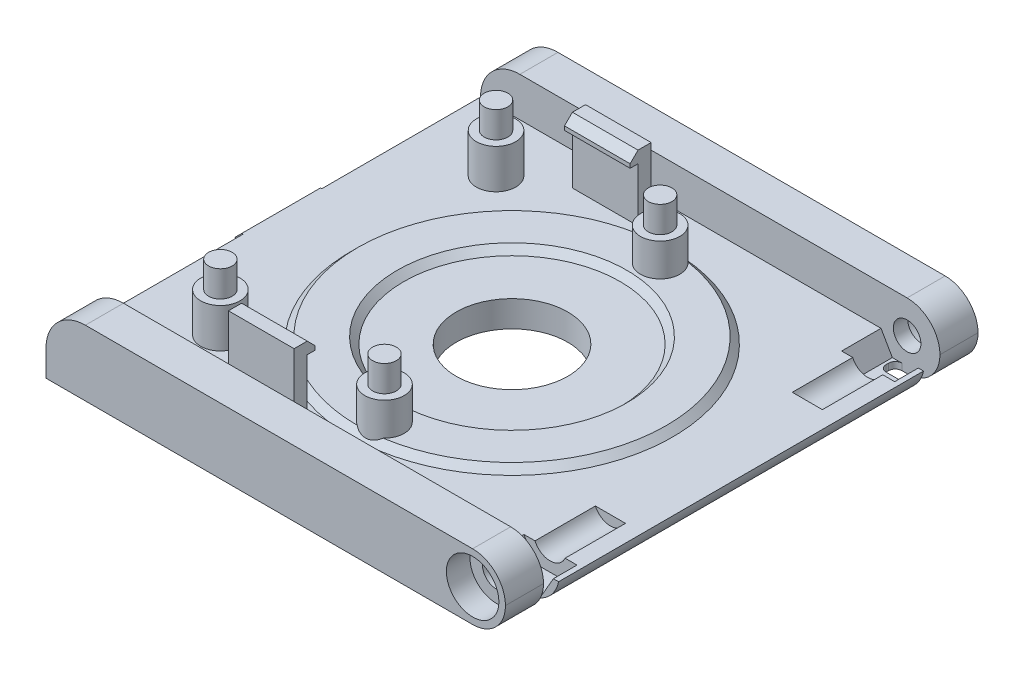
from build123d import *

# Parameters (mm, degrees)
EXTRUDE_2_DEPTH      = 7
EXTRUDE_4_DEPTH      = 1
SKETCH_7_W           = 0.8
SKETCH_7_H           = 10
EXTRUDE_8_DEPTH      = 2.8
SKETCH_8_R           = 0.7
EXTRUDE_9_DEPTH      = 10
FILLET_3_R           = 0.5
SKETCH_13_W          = 0.8
SKETCH_13_H          = 2
CUT_EXTRUDE_2_DEPTH  = 1
CUT_EXTRUDE_START    = -5
CUT_EXTRUDE_3_DEPTH  = 5
SKETCH_19_R          = 4.25
CUT_EXTRUDE_4_DEPTH  = 3
SKETCH_21_R          = 1.5
EXTRUDE_11_DEPTH     = 3
SKETCH_22_R          = 0.9
EXTRUDE_12_DEPTH     = 2
SKETCH_28_W          = 5
SKETCH_28_H          = 1
EXTRUDE_16_DEPTH     = 5
FILLET_4_R           = 1
SKETCH_29_W          = 5
SKETCH_29_H          = 0.9
EXTRUDE_17_DEPTH     = 0.6
SKETCH_30_W          = 5
SKETCH_30_H          = 0.9
EXTRUDE_18_DEPTH     = 0.6
CHAMFER_5_SIZE       = 0.6
CUT_EXTRUDE_5_DEPTH  = 0.5
SKETCH_34_W          = 0.8
SKETCH_34_H          = 12
CUT_EXTRUDE_6_DEPTH  = 1
SKETCH_35_W          = 0.8
SKETCH_35_H          = 10
EXTRUDE_19_DEPTH     = 2.8
SKETCH_36_R          = 0.7
EXTRUDE_20_DEPTH     = 10
FILLET_5_R           = 0.5
FILLET_6_R           = 1
SKETCH_37_R          = 11.75
SKETCH_37_R_2        = 9.25
CUT_EXTRUDE_7_DEPTH  = 1.5
CHAMFER_6_SIZE       = 1.2
CHAMFER_7_SIZE       = 0.5
SKETCH_38_R          = 12.25
SKETCH_38_R_2        = 8.25
EXTRUDE_21_DEPTH     = 0.5
CHAMFER_8_SIZE       = 0.5
SKETCH_39_W          = 27.918227535
SKETCH_39_H          = 36
SKETCH_39_W_2        = 30.545728302
CUT_EXTRUDE_8_DEPTH  = 10
SKETCH_40_W          = 35
SKETCH_40_H          = 3
CUT_EXTRUDE_9_DEPTH  = 2.9
SKETCH_41_W          = 35
SKETCH_41_H          = 3
CUT_EXTRUDE_10_DEPTH = 2.9
FILLET_9_R           = 2.5
CUT_EXTRUDE_12_REACH = 40.823
SKETCH_44_R          = 1.05
FILLET_10_R          = 3
CUT_EXTRUDE_14_REACH = 40.823
SKETCH_47_R          = 1.05
SKETCH_50_R          = 2
CUT_EXTRUDE_17_DEPTH = 1.8
CUT_EXTRUDE_START_2  = -1.8
SKETCH_51_R          = 2
CUT_EXTRUDE_18_DEPTH = 1.8
CUT_EXTRUDE_21_DEPTH = 3
CUT_EXTRUDE_22_DEPTH = 3
CUT_EXTRUDE_23_REACH = 38.299
SKETCH_57_R          = 1.25
SKETCH_58_W          = 3.4
SKETCH_58_H          = 1.2
CUT_EXTRUDE_24_DEPTH = 10
SKETCH_59_W          = 2.291287848
SKETCH_59_H          = 15
EXTRUDE_22_DEPTH     = 1.5
FILLET_11_R          = 0.5
SKETCH_62_W          = 6
SKETCH_62_H          = 1
EXTRUDE_25_DEPTH     = 0.6
CHAMFER_10_SIZE      = 0.5


# Some blends are built 0.0001 mm under size
with BuildPart() as part:
    # case 2 → 凸台-拉伸2 (new body)
    with BuildSketch(Plane(origin=(0, 0, 0), x_dir=(1, 0, 0), z_dir=(0, 1, 0))):
        with BuildLine():
            Line((-34.042196447, 18), (30.957803553, 18))
            ThreePointArc((30.957803553, 18), (34.493337459, 16.535533906), (35.957803553, 13))
            Line((35.957803553, 13), (35.957803553, -13))
            ThreePointArc((35.957803553, -13), (34.493337459, -16.535533906), (30.957803553, -18))
            Line((30.957803553, -18), (-34.042196447, -18))
            ThreePointArc((-34.042196447, -18), (-37.577730353, -16.535533906), (-39.042196447, -13))
            Line((-39.042196447, -13), (-39.042196447, 13))
            ThreePointArc((-39.042196447, 13), (-37.577730353, 16.535533906), (-34.042196447, 18))
        make_face()
    extrude(amount=EXTRUDE_2_DEPTH)

    # 草图3 → 凸台-拉伸4 (add)
    with BuildSketch(Plane(origin=(0, 7, 0), x_dir=(1, 0, 0), z_dir=(0, 1, 0))):
        with BuildLine():
            Line((-36.942196447, 13), (-36.942196447, -13))
            ThreePointArc((-36.942196447, -13), (-35.997398295, -14.955201848), (-34.042196447, -15.9))
            Line((-34.042196447, -15.9), (30.957803553, -15.9))
            ThreePointArc((30.957803553, -15.9), (32.913005401, -14.955201848), (33.857803553, -13))
            Line((33.857803553, -13), (33.857803553, 13))
            ThreePointArc((33.857803553, 13), (32.913005401, 14.955201848), (30.957803553, 15.9))
            Line((30.957803553, 15.9), (-34.042196447, 15.9))
            ThreePointArc((-34.042196447, 15.9), (-35.997398295, 14.955201848), (-36.942196447, 13))
        make_face()
        with BuildLine():
            Line((-34.042196447, -15.1), (30.957803553, -15.1))
            ThreePointArc((30.957803553, -15.1), (32.371630665, -14.413827112), (33.057803553, -13))
            Line((33.057803553, -13), (33.057803553, 13))
            ThreePointArc((33.057803553, 13), (32.371630665, 14.413827112), (30.957803553, 15.1))
            Line((30.957803553, 15.1), (-34.042196447, 15.1))
            ThreePointArc((-34.042196447, 15.1), (-35.456023559, 14.413827112), (-36.142196447, 13))
            Line((-36.142196447, 13), (-36.142196447, -13))
            ThreePointArc((-36.142196447, -13), (-35.456023559, -14.413827112), (-34.042196447, -15.1))
        make_face(mode=Mode.SUBTRACT)
    extrude(amount=EXTRUDE_4_DEPTH)

    # 草图7 → 凸台-拉伸8 (add)
    with BuildSketch(Plane(origin=(0, 7, 0), x_dir=(1, 0, 0), z_dir=(0, 1, 0))):
        with Locations((-36.542196447, 0)):
            Rectangle(SKETCH_7_W, SKETCH_7_H)
    extrude(amount=EXTRUDE_8_DEPTH)

    # 草图8 → 凸台-拉伸9 (add)
    with BuildSketch(Plane.XY.offset(5)):
        with Locations((-36.692196447, 8.6)):
            Circle(SKETCH_8_R)
    extrude(amount=-EXTRUDE_9_DEPTH)

    # 圆角3
    fillet_3_edges = [part.edges().sort_by_distance(p)[0] for p in [
        (-36.942196447, 9.8, 0),
    ]]
    fillet(fillet_3_edges, radius=FILLET_3_R)

    # 草图13 → 切除-拉伸2 (cut)
    with BuildSketch(Plane(origin=(0, 8, 0), x_dir=(1, 0, 0), z_dir=(0, 1, 0))):
        with Locations((-36.542196447, -6)):
            Rectangle(SKETCH_13_W, SKETCH_13_H)
        with Locations((-36.542196447, 6)):
            Rectangle(SKETCH_13_W, SKETCH_13_H)
    extrude(amount=-CUT_EXTRUDE_2_DEPTH, mode=Mode.SUBTRACT)

    # 草图15 → 切除-拉伸3 (cut)
    with BuildSketch(Plane(origin=(0, 7, 0), x_dir=(1, 0, 0), z_dir=(0, 1, 0)).offset(CUT_EXTRUDE_START)):
        with BuildLine():
            Line((-34.042196447, -15.1), (30.957803553, -15.1))
            ThreePointArc((30.957803553, -15.1), (32.371630665, -14.413827112), (33.057803553, -13))
            Line((33.057803553, -13), (33.057803553, 13))
            ThreePointArc((33.057803553, 13), (32.371630665, 14.413827112), (30.957803553, 15.1))
            Line((30.957803553, 15.1), (-34.042196447, 15.1))
            ThreePointArc((-34.042196447, 15.1), (-35.456023559, 14.413827112), (-36.142196447, 13))
            Line((-36.142196447, 13), (-36.142196447, -13))
            ThreePointArc((-36.142196447, -13), (-35.456023559, -14.413827112), (-34.042196447, -15.1))
        make_face()
    extrude(amount=CUT_EXTRUDE_3_DEPTH, mode=Mode.SUBTRACT)

    # 草图19 → 切除-拉伸4 (cut)
    with BuildSketch(Plane(origin=(0, 2, 0), x_dir=(1, 0, 0), z_dir=(0, 1, 0))):
        with Locations(Location((-1.542196447, 0, 0), (0, 0, 270))):
            Circle(SKETCH_19_R)
    extrude(amount=-CUT_EXTRUDE_4_DEPTH, mode=Mode.SUBTRACT)

    # 草图21 → 凸台-拉伸11 (add)
    with BuildSketch(Plane(origin=(0, 2, 0), x_dir=(1, 0, 0), z_dir=(0, 1, 0))):
        with Locations(Location((-13.257466081, 10.5, 0), (0, 0, 270))):
            Circle(SKETCH_21_R)
        with Locations(Location((-0.757466081, 10.5, 0), (0, 0, 270))):
            Circle(SKETCH_21_R)
        with Locations(Location((-13.257466081, -10.5, 0), (0, 0, 270))):
            Circle(SKETCH_21_R)
        with Locations(Location((-0.757466081, -10.5, 0), (0, 0, 270))):
            Circle(SKETCH_21_R)
    extrude(amount=EXTRUDE_11_DEPTH)

    # 草图22 → 凸台-拉伸12 (add)
    with BuildSketch(Plane(origin=(0, 5, 0), x_dir=(1, 0, 0), z_dir=(0, 1, 0))):
        with Locations(Location((-13.257466081, -10.5, 0), (0, 0, 270))):
            Circle(SKETCH_22_R)
        with Locations(Location((-0.757466081, -10.5, 0), (0, 0, 270))):
            Circle(SKETCH_22_R)
        with Locations(Location((-13.257466081, 10.5, 0), (0, 0, 270))):
            Circle(SKETCH_22_R)
        with Locations(Location((-0.757466081, 10.5, 0), (0, 0, 270))):
            Circle(SKETCH_22_R)
    extrude(amount=EXTRUDE_12_DEPTH)

    # 草图28 → 凸台-拉伸16 (add)
    with BuildSketch(Plane(origin=(0, 2, 0), x_dir=(1, 0, 0), z_dir=(0, 1, 0))):
        with Locations((-7.042196447, -13.1)):
            Rectangle(SKETCH_28_W, SKETCH_28_H)
        with Locations((-7.042196447, 13.1)):
            Rectangle(SKETCH_28_W, SKETCH_28_H)
    extrude(amount=EXTRUDE_16_DEPTH)

    # 圆角4
    fillet_4_edges = [part.edges().sort_by_distance(p)[0] for p in [
        (-7.042196447, 2, 13.6),
        (-7.042196447, 2, -13.6),
    ]]
    fillet(fillet_4_edges, radius=FILLET_4_R)

    # 草图29 → 凸台-拉伸17 (add)
    with BuildSketch(Plane(origin=(0, 0, 12.6), x_dir=(-1, 0, 0), z_dir=(0, 0, -1))):
        with Locations((7.042196447, 6.55)):
            Rectangle(SKETCH_29_W, SKETCH_29_H)
    extrude(amount=EXTRUDE_17_DEPTH)

    # 草图30 → 凸台-拉伸18 (add)
    with BuildSketch(Plane.XY.offset(-12.6)):
        with Locations((-7.042196447, 6.55)):
            Rectangle(SKETCH_30_W, SKETCH_30_H)
    extrude(amount=EXTRUDE_18_DEPTH)

    # 倒角5
    chamfer_5_edges = [part.edges().sort_by_distance(p)[0] for p in [
        (-7.042196447, 7, 12),
        (-7.042196447, 7, -12),
    ]]
    chamfer(chamfer_5_edges, length=CHAMFER_5_SIZE)

    # 草图33 → 切除-拉伸5 (cut)
    with BuildSketch(Plane.XZ):
        with BuildLine():
            Line((31.452844049, 12.8823111), (31.128302993, 13.069384422))
            Line((31.128302993, 13.069384422), (29.444684359, 14.04079281))
            Line((29.444684359, 14.04079281), (29.120143303, 14.230122183))
            add(Edge.make_bspline(
                [(29.120143303, 14.230122183), (29.014191488, 14.288710703), (28.897014448, 14.320267891), (28.779809896, 14.320267891)],
                knots=[3, 3, 3, 3, 4, 4, 4, 4], degree=3))
            add(Edge.make_bspline(
                [(28.779809896, 14.320267891), (28.662605343, 14.320267891), (28.545400791, 14.288710703), (28.439476489, 14.230122183)],
                knots=[4, 4, 4, 4, 5, 5, 5, 5], degree=3))
            Line((28.439476489, 14.230122183), (28.11490792, 14.04079281))
            Line((28.11490792, 14.04079281), (26.431289286, 13.069384422))
            Line((26.431289286, 13.069384422), (26.106720717, 12.8823111))
            add(Edge.make_bspline(
                [(26.106720717, 12.8823111), (25.897128163, 12.760608203), (25.76638731, 12.535223299), (25.76638731, 12.2940598)],
                knots=[8, 8, 8, 8, 9, 9, 9, 9], degree=3))
            Line((25.76638731, 12.2940598), (25.76638731, 9.59845139))
            add(Edge.make_bspline(
                [(25.76638731, 9.59845139), (25.76638731, 9.355045597), (25.897128163, 9.131902987), (26.106720717, 9.01020009)],
                knots=[10, 10, 10, 10, 11, 11, 11, 11], degree=3))
            Line((26.106720717, 9.01020009), (26.431289286, 8.823126768))
            Line((26.431289286, 8.823126768), (28.11490792, 7.851718379))
            Line((28.11490792, 7.851718379), (28.439476489, 7.662402763))
            add(Edge.make_bspline(
                [(28.439476489, 7.662402763), (28.545400791, 7.601544437), (28.662605343, 7.572243299), (28.779809896, 7.572243299)],
                knots=[14, 14, 14, 14, 15, 15, 15, 15], degree=3))
            add(Edge.make_bspline(
                [(28.779809896, 7.572243299), (28.897014448, 7.572243299), (29.014191488, 7.601544437), (29.120143303, 7.662402763)],
                knots=[15, 15, 15, 15, 16, 16, 16, 16], degree=3))
            Line((29.120143303, 7.662402763), (29.444684359, 7.851718379))
            Line((29.444684359, 7.851718379), (31.128302993, 8.823126768))
            Line((31.128302993, 8.823126768), (31.452844049, 9.01020009))
            add(Edge.make_bspline(
                [(31.452844049, 9.01020009), (31.664720166, 9.131902987), (31.793177456, 9.355045597), (31.793177456, 9.59845139)],
                knots=[19, 19, 19, 19, 20, 20, 20, 20], degree=3))
            Line((31.793177456, 9.59845139), (31.793177456, 12.2940598))
            add(Edge.make_bspline(
                [(31.793177456, 12.2940598), (31.793177456, 12.535223299), (31.664720166, 12.760608203), (31.452844049, 12.8823111)],
                knots=[21, 21, 21, 21, 22, 22, 22, 22], degree=3))
        make_face()
        with BuildLine():
            Line((26.539469638, 12.614102513), (28.622023955, 13.817663956))
            add(Edge.make_bspline(
                [(28.622023955, 13.817663956), (28.71895157, 13.874010182), (28.840668222, 13.874010182), (28.939824374, 13.817663956)],
                knots=[3, 3, 3, 3, 4, 4, 4, 4], degree=3))
            Line((28.939824374, 13.817663956), (31.011098441, 12.611846463))
            add(Edge.make_bspline(
                [(31.011098441, 12.611846463), (31.117022743, 12.551001893), (31.119278793, 12.397741809), (31.013354491, 12.334627432)],
                knots=[5, 5, 5, 5, 6, 6, 6, 6], degree=3))
            Line((31.013354491, 12.334627432), (29.0006827, 11.131079746))
            add(Edge.make_bspline(
                [(29.0006827, 11.131079746), (28.865429747, 11.052186775), (28.696391069, 11.052186775), (28.561165629, 11.131079746)],
                knots=[7, 7, 7, 7, 8, 8, 8, 8], degree=3))
            add(Edge.make_bspline(
                [(28.561165629, 11.131079746), (26.5237048, 12.307582344), (26.5191927, 12.309838394)],
                knots=[0, 0, 0, 1, 1, 1], degree=2))
            add(Edge.make_bspline(
                [(26.5191927, 12.309838394), (26.413268398, 12.386461558), (26.424521136, 12.548745843), (26.539469638, 12.614102513)],
                knots=[1, 1, 1, 1, 2, 2, 2, 2], degree=3))
        make_face(mode=Mode.SUBTRACT)
        with BuildLine():
            Line((29.625003288, 9.091335354), (29.390594183, 8.960622014))
            Line((29.390594183, 8.960622014), (29.390594183, 9.388845079))
            Line((29.390594183, 9.388845079), (29.597930687, 9.492527088))
            add(Edge.make_bspline(
                [(29.976589432, 10.040210755), (29.976589432, 9.826092344), (29.854900293, 9.636776728), (29.597930687, 9.492527088)],
                knots=[0, 0, 0, 0, 1, 1, 1, 1], degree=3))
            add(Edge.make_bspline(
                [(29.584421899, 10.114591625), (29.836851892, 10.258827509), (29.976589432, 10.261083559), (29.976589432, 10.040210755)],
                knots=[6, 6, 6, 6, 7, 7, 7, 7], degree=3))
            Line((29.584421899, 10.114591625), (29.390594183, 10.006397517))
            add(Edge.make_bspline(
                [(29.368033682, 9.968085935), (29.368033682, 9.983864529), (29.377057883, 9.999643123), (29.390594183, 10.006397517)],
                knots=[4, 4, 4, 4, 5, 5, 5, 5], degree=3))
            Line((29.368033682, 9.968085935), (29.368033682, 9.436180861))
            Line((29.368033682, 9.436180861), (29.368033682, 8.922296676))
            Line((29.368033682, 8.922296676), (29.368033682, 8.246141962))
            add(Edge.make_bspline(
                [(29.368033682, 8.246141962), (29.368033682, 8.230363368), (29.361293045, 8.216840824), (29.345528207, 8.20783038)],
                knots=[3, 3, 3, 3, 4, 4, 4, 4], degree=3))
            Line((29.345528207, 8.20783038), (28.908267186, 7.959912488))
            add(Edge.make_bspline(
                [(28.908267186, 7.959912488), (28.878966048, 7.944133894), (28.842896759, 7.964410832), (28.842896759, 7.99822407)],
                knots=[5, 5, 5, 5, 6, 6, 6, 6], degree=3))
            Line((28.842896759, 7.99822407), (28.842896759, 10.085290487))
            add(Edge.make_bspline(
                [(28.842896759, 10.085290487), (28.842896759, 10.101069081), (28.84966491, 10.116847675), (28.865429747, 10.123602069)],
                knots=[7, 7, 7, 7, 8, 8, 8, 8], degree=3))
            Line((28.865429747, 10.123602069), (29.609210937, 10.54507074))
            add(Edge.make_bspline(
                [(29.609210937, 10.54507074), (30.091537935, 10.817791427), (30.490446105, 10.871881603), (30.490446105, 10.330952329)],
                knots=[9, 9, 9, 9, 10, 10, 10, 10], degree=3))
            add(Edge.make_bspline(
                [(30.490446105, 10.330952329), (30.490446105, 9.81031375), (30.087025835, 9.352789547), (29.625003288, 9.091335354)],
                knots=[10, 10, 10, 10, 11, 11, 11, 11], degree=3))
        make_face(mode=Mode.SUBTRACT)
        with BuildLine():
            Line((31.168856869, 9.231072895), (30.73613546, 8.985411052))
            add(Edge.make_bspline(
                [(30.73613546, 8.985411052), (30.706834322, 8.969632458), (30.670765034, 8.989923153), (30.670765034, 9.023722634)],
                knots=[2, 2, 2, 2, 3, 3, 3, 3], degree=3))
            Line((30.670765034, 9.023722634), (30.670765034, 10.017677767))
            add(Edge.make_bspline(
                [(30.670765034, 10.017677767), (30.670765034, 10.033442605), (30.679789234, 10.046978905), (30.693325534, 10.055989349)],
                knots=[4, 4, 4, 4, 5, 5, 5, 5], degree=3))
            Line((30.693325534, 10.055989349), (31.126046943, 10.299408898))
            add(Edge.make_bspline(
                [(31.126046943, 10.299408898), (31.155348081, 10.315173735), (31.191417369, 10.294896798), (31.191417369, 10.261083559)],
                knots=[6, 6, 6, 6, 7, 7, 7, 7], degree=3))
            Line((31.191417369, 10.261083559), (31.191417369, 9.269398233))
            add(Edge.make_bspline(
                [(31.191417369, 9.269398233), (31.191417369, 9.253619639), (31.182393169, 9.237841045), (31.168856869, 9.231072895)],
                knots=[0, 0, 0, 0, 1, 1, 1, 1], degree=3))
        make_face(mode=Mode.SUBTRACT)
        with BuildLine():
            add(Edge.make_bspline(
                [(30.932219227, 10.959785017), (31.105770005, 11.058954925), (31.229715195, 11.016131243), (31.229715195, 10.858359059), (31.229715195, 10.702842924), (31.105770005, 10.520281702), (30.932219227, 10.423367844)],
                knots=[2, 2, 2, 2, 3, 3, 3, 4, 4, 4, 4], degree=3))
            add(Edge.make_bspline(
                [(30.932219227, 10.423367844), (30.756439911, 10.321941886), (30.632467208, 10.364765568), (30.632467208, 10.520281702), (30.632467208, 10.680309937), (30.756439911, 10.860615109), (30.932219227, 10.959785017)],
                knots=[0, 0, 0, 0, 1, 1, 1, 2, 2, 2, 2], degree=3))
        make_face(mode=Mode.SUBTRACT)
    extrude(amount=-CUT_EXTRUDE_5_DEPTH, mode=Mode.SUBTRACT)

    # 草图34 → 切除-拉伸6 (cut)
    with BuildSketch(Plane(origin=(0, 8, 0), x_dir=(1, 0, 0), z_dir=(0, 1, 0))):
        with Locations((33.457803553, 0)):
            Rectangle(SKETCH_34_W, SKETCH_34_H)
    extrude(amount=-CUT_EXTRUDE_6_DEPTH, mode=Mode.SUBTRACT)

    # 草图35 → 凸台-拉伸19 (add)
    with BuildSketch(Plane(origin=(0, 7, 0), x_dir=(1, 0, 0), z_dir=(0, 1, 0))):
        with Locations((33.457803553, 0)):
            Rectangle(SKETCH_35_W, SKETCH_35_H)
    extrude(amount=EXTRUDE_19_DEPTH)

    # 草图36 → 凸台-拉伸20 (add)
    with BuildSketch(Plane(origin=(0, 0, -5), x_dir=(-1, 0, 0), z_dir=(0, 0, -1))):
        with Locations((-33.609627041, 8.6)):
            Circle(SKETCH_36_R)
    extrude(amount=-EXTRUDE_20_DEPTH)

    # 圆角5
    fillet_5_edges = [part.edges().sort_by_distance(p)[0] for p in [
        (33.857803553, 9.8, 0),
    ]]
    fillet(fillet_5_edges, radius=FILLET_5_R)

    # 圆角6
    fillet_6_edges = [part.edges().sort_by_distance(p)[0] for p in [
        (33.457803553, 8, -6),
        (33.457803553, 8, 6),
        (-36.542196447, 8, 7),
        (-36.542196447, 8, -7),
    ]]
    fillet(fillet_6_edges, radius=FILLET_6_R - 0.0001)  # a hair under: the kernel refuses the full size

    # 草图37 → 切除-拉伸7 (cut)
    with BuildSketch(Plane.XZ):
        with Locations(Location((-1.542196447, 0, 0), (0, 0, 270))):
            Circle(SKETCH_37_R)
        with Locations(Location((-1.542196447, 0, 0), (0, 0, 270))):
            Circle(SKETCH_37_R_2, mode=Mode.SUBTRACT)
    extrude(amount=-CUT_EXTRUDE_7_DEPTH, mode=Mode.SUBTRACT)

    # 倒角6
    chamfer_6_edges = [part.edges().sort_by_distance(p)[0] for p in [
        (-1.542196447, 0, 9.25),
    ]]
    chamfer(chamfer_6_edges, length=CHAMFER_6_SIZE)

    # 倒角7
    chamfer_7_edges = [part.edges().sort_by_distance(p)[0] for p in [
        (-1.542196447, 0, 11.75),
    ]]
    chamfer(chamfer_7_edges, length=CHAMFER_7_SIZE)

    # 草图38 → 凸台-拉伸21 (add)
    with BuildSketch(Plane(origin=(0, 2, 0), x_dir=(1, 0, 0), z_dir=(0, 1, 0))):
        with Locations(Location((-1.542196447, 0, 0), (0, 0, 270))):
            Circle(SKETCH_38_R)
        with Locations(Location((-1.542196447, 0, 0), (0, 0, 270))):
            Circle(SKETCH_38_R_2, mode=Mode.SUBTRACT)
    extrude(amount=EXTRUDE_21_DEPTH)

    # 倒角8
    # the kernel refuses this chamfer: 0.5 mm, written as the material it takes off along each edge
    with BuildSketch(Plane(origin=(-1.542196447, 2.5, 0), x_dir=(0, 0, 1), z_dir=(-1, 0, 0))) as chamfer_8_piece_1_section:
        Polygon((12.25, -CHAMFER_8_SIZE), (12.25 - CHAMFER_8_SIZE, 0), (12.25, 0), align=None)
    chamfer_8_piece_1 = revolve(axis=Axis((-1.542196447, 2.5, 0), (0, 1, 0)), mode=Mode.PRIVATE)
    chamfer_8_piece_1 = split(chamfer_8_piece_1, bisect_by=Plane(origin=(-1.542196447, 2, -12.008331629), z_dir=(0, 1, 0)), keep=Keep.TOP, mode=Mode.PRIVATE)
    chamfer_8_piece_1 = chamfer_8_piece_1 - Plane(origin=(-0.757466081, 2.272473764, 10.5), x_dir=(0, 0, 1), z_dir=(0, -1, 0)) * Cylinder(1.5, 49, mode=Mode.PRIVATE)
    chamfer_8_piece_1 = chamfer_8_piece_1 - Plane(origin=(-0.757466081, 2.272473764, -10.5), x_dir=(0, 0, 1), z_dir=(0, -1, 0)) * Cylinder(1.5, 49, mode=Mode.PRIVATE)
    add(chamfer_8_piece_1, mode=Mode.SUBTRACT)
    with BuildSketch(Plane(origin=(-1.542196447, 2.5, 0), x_dir=(0, 0, 1), z_dir=(-1, 0, 0))) as chamfer_8_piece_2_section:
        Polygon((8.25, -CHAMFER_8_SIZE), (8.25 + CHAMFER_8_SIZE, 0), (8.25, 0), align=None)
    chamfer_8_piece_2 = revolve(axis=Axis((-1.542196447, 2.5, 0), (0, 1, 0)), mode=Mode.PRIVATE)
    chamfer_8_piece_2 = split(chamfer_8_piece_2, bisect_by=Plane(origin=(-1.542196447, 2, -8.493378633), z_dir=(0, 1, 0)), keep=Keep.TOP, mode=Mode.PRIVATE)
    add(chamfer_8_piece_2, mode=Mode.SUBTRACT)

    # 草图39 → 切除-拉伸8 (cut)
    with BuildSketch(Plane.XZ):
        with Locations((29.916917321, 0)):
            Rectangle(SKETCH_39_W, SKETCH_39_H)
        with Locations((-34.315060598, 0)):
            Rectangle(SKETCH_39_W_2, SKETCH_39_H)
    extrude(amount=-CUT_EXTRUDE_8_DEPTH, mode=Mode.SUBTRACT)

    # 草图40 → 切除-拉伸9 (cut)
    with BuildSketch(Plane.XY.offset(18)):
        with Locations((-1.542196447, 6.5)):
            Rectangle(SKETCH_40_W, SKETCH_40_H)
    extrude(amount=-CUT_EXTRUDE_9_DEPTH, mode=Mode.SUBTRACT)

    # 草图41 → 切除-拉伸10 (cut)
    with BuildSketch(Plane(origin=(0, 0, -18), x_dir=(-1, 0, 0), z_dir=(0, 0, -1))):
        with Locations((1.542196447, 6.5)):
            Rectangle(SKETCH_41_W, SKETCH_41_H)
    extrude(amount=-CUT_EXTRUDE_10_DEPTH, mode=Mode.SUBTRACT)

    # 圆角9
    # the kernel refuses this fillet: 2.5 mm, written as the material it takes off along each edge
    with BuildSketch(Plane(origin=(15.957803553, 5, 24.25), x_dir=(0, -1, 0), z_dir=(0, 0, -1))) as fillet_9_piece_1:
        with BuildLine():
            CenterArc((FILLET_9_R, FILLET_9_R), FILLET_9_R, 180, 90)
            Line((0, FILLET_9_R), (0, 0))
            Line((0, 0), (FILLET_9_R, 0))
        make_face()
    extrude(amount=15.4, mode=Mode.SUBTRACT)
    with BuildSketch(Plane(origin=(15.957803553, 5, -24.25), x_dir=(0, -1, 0), z_dir=(0, 0, 1))) as fillet_9_piece_2:
        with BuildLine():
            CenterArc((FILLET_9_R, -FILLET_9_R), FILLET_9_R, 90, 90)
            Line((0, -FILLET_9_R), (0, 0))
            Line((0, 0), (FILLET_9_R, 0))
        make_face()
    extrude(amount=15.4, mode=Mode.SUBTRACT)
    with BuildSketch(Plane(origin=(15.957803553, 0, 24.25), x_dir=(-1, 0, 0), z_dir=(0, 0, -1))) as fillet_9_piece_3:
        with BuildLine():
            CenterArc((FILLET_9_R, FILLET_9_R), FILLET_9_R, 180, 90)
            Line((0, FILLET_9_R), (0, 0))
            Line((0, 0), (FILLET_9_R, 0))
        make_face()
    extrude(amount=48.5, mode=Mode.SUBTRACT)

    # 草图44 → 切除-拉伸12 (cut, up to next)
    with BuildSketch(Plane(origin=(0, 0, 15.1), x_dir=(-1, 0, 0), z_dir=(0, 0, -1)), mode=Mode.PRIVATE) as cut_extrude_12_sk1:
        with Locations((-13.457803553, 2.5)):
            Circle(SKETCH_44_R)
    cut_extrude_12_tool1 = extrude(cut_extrude_12_sk1.sketch, amount=-CUT_EXTRUDE_12_REACH, mode=Mode.PRIVATE) & part.part
    add(cut_extrude_12_tool1.solids().sort_by_distance((13.457804, 2.5, 15.1))[0], mode=Mode.SUBTRACT)

    # 圆角10
    fillet_10_edges = [part.edges().sort_by_distance(p)[0] for p in [
        (-19.042196447, 5, -16.55),
        (-19.042196447, 5, 16.55),
    ]]
    fillet(fillet_10_edges, radius=FILLET_10_R)

    # 草图47 → 切除-拉伸14 (cut, up to next)
    with BuildSketch(Plane.XY.offset(-15.1), mode=Mode.PRIVATE) as cut_extrude_14_sk1:
        with Locations(Location((13.457803553, 2.5, 0), (0, 0, 180))):
            Circle(SKETCH_47_R)
    cut_extrude_14_tool1 = extrude(cut_extrude_14_sk1.sketch, amount=-CUT_EXTRUDE_14_REACH, mode=Mode.PRIVATE) & part.part
    add(cut_extrude_14_tool1.solids().sort_by_distance((13.457804, 2.5, -15.1))[0], mode=Mode.SUBTRACT)

    # 草图50 → 切除-拉伸17 (cut)
    with BuildSketch(Plane(origin=(0, 0, -18), x_dir=(-1, 0, 0), z_dir=(0, 0, -1))):
        with Locations((-13.457803553, 2.5)):
            Circle(SKETCH_50_R)
    extrude(amount=-CUT_EXTRUDE_17_DEPTH, mode=Mode.SUBTRACT)

    # 草图51 → 切除-拉伸18 (cut)
    with BuildSketch(Plane.XY.offset(18).offset(CUT_EXTRUDE_START_2)):
        with Locations(Location((13.457803553, 2.5, 0), (0, 0, 180))):
            Circle(SKETCH_51_R)
    extrude(amount=CUT_EXTRUDE_18_DEPTH, mode=Mode.SUBTRACT)

    # 草图55 → 切除-拉伸21 (cut)
    with BuildSketch(Plane.XY.offset(-15.1)):
        Polygon((14.644207093, 0.500154246), (15.798907632, 2.500154246), (14.644207093, 4.500154246), (12.334806017, 4.500154246), (11.180105478, 2.500154246), (12.334806017, 0.500154246), align=None)
    extrude(amount=CUT_EXTRUDE_21_DEPTH, mode=Mode.SUBTRACT)

    # 草图56 → 切除-拉伸22 (cut)
    with BuildSketch(Plane(origin=(0, 0, 15.1), x_dir=(-1, 0, 0), z_dir=(0, 0, -1))):
        Polygon((-15.798907632, 2.500154246), (-14.644207093, 0.500154246), (-12.334806017, 0.500154246), (-11.180105478, 2.500154246), (-12.334806017, 4.500154246), (-14.644207093, 4.500154246), align=None)
    extrude(amount=CUT_EXTRUDE_22_DEPTH, mode=Mode.SUBTRACT)

    # 草图57 → 切除-拉伸23 (cut, up to next)
    with BuildSketch(Plane.XY.offset(12.1), mode=Mode.PRIVATE) as cut_extrude_23_sk1:
        with Locations((13.457803553, 2.5)):
            Circle(SKETCH_57_R)
    cut_extrude_23_tool1 = extrude(cut_extrude_23_sk1.sketch, amount=-CUT_EXTRUDE_23_REACH, mode=Mode.PRIVATE) & part.part
    add(cut_extrude_23_tool1.solids().sort_by_distance((13.457804, 2.5, 12.1))[0], mode=Mode.SUBTRACT)

    # 草图58 → 切除-拉伸24 (cut)
    with BuildSketch(Plane.XZ):
        with Locations((14.257803553, -14.5)):
            Rectangle(SKETCH_58_W, SKETCH_58_H)
        with Locations((14.257803553, 14.5)):
            Rectangle(SKETCH_58_W, SKETCH_58_H)
    extrude(amount=-CUT_EXTRUDE_24_DEPTH, mode=Mode.SUBTRACT)

    # 草图59 → 凸台-拉伸22 (add)
    with BuildSketch(Plane(origin=(0, 2, 0), x_dir=(1, 0, 0), z_dir=(0, 1, 0))):
        with Locations((13.457803553, 0)):
            Rectangle(SKETCH_59_W, SKETCH_59_H)
    extrude(amount=-EXTRUDE_22_DEPTH)

    # 圆角11
    fillet_11_edges = [part.edges().sort_by_distance(p)[0] for p in [
        (12.557803553, 0.250077123, -15.1),
        (12.557803553, 0.250077123, -13.9),
        (12.557803553, 0.250077123, 13.9),
        (12.557803553, 0.250077123, 15.1),
    ]]
    fillet(fillet_11_edges, radius=FILLET_11_R)

    # 草图62 → 凸台-拉伸25 (add)
    with BuildSketch(Plane.ZY.offset(19.042196447)):
        with Locations((0, 1.5)):
            Rectangle(SKETCH_62_W, SKETCH_62_H)
    extrude(amount=EXTRUDE_25_DEPTH)

    # 倒角10
    chamfer_10_edges = [part.edges().sort_by_distance(p)[0] for p in [
        (-19.642196447, 2, 0),
        (-19.642196447, 1, 0),
    ]]
    chamfer(chamfer_10_edges, length=CHAMFER_10_SIZE - 0.0001)  # a hair under: the kernel refuses the full size


solid = part.part
